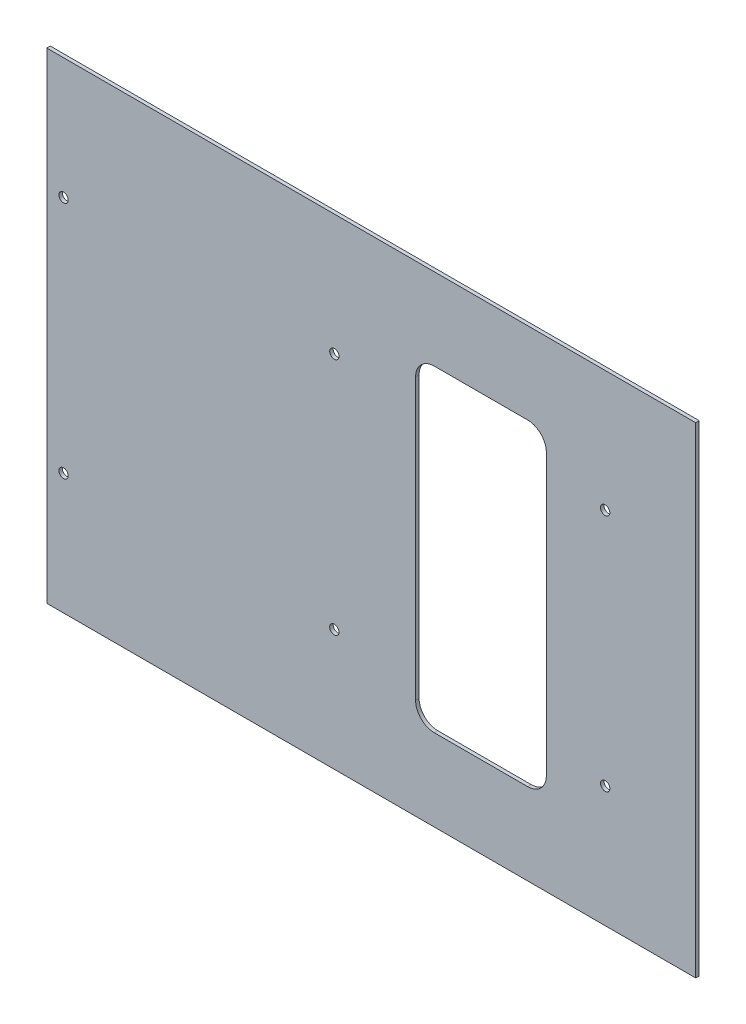
from build123d import *

# Parameters (mm, degrees)
SKETCH1_W          = 882.65
SKETCH1_H          = 654.05
EXTRUDE1_DEPTH     = 4.7625
SKETCH2_R          = 6.35
CUT_EXTRUDE1_DEPTH = 1344.256823743
SKETCH3_W          = 177.8
SKETCH3_H          = 431.8
CUT_EXTRUDE2_DEPTH = 1344.256823743
FILLET1_R          = 25.4


with BuildPart() as part:
    # Sketch1 → Extrude1 (new body)
    with BuildSketch(Plane.XY):
        with Locations((-835.025, 91.6)):
            Rectangle(SKETCH1_W, SKETCH1_H)
    extrude(amount=EXTRUDE1_DEPTH)

    # Sketch2 → Cut-Extrude1 (cut, through all)
    with BuildSketch(Plane(origin=(0, 0, 0), x_dir=(-1, 0, 0), z_dir=(0, 0, -1))):
        with Locations((516.89, 254)):
            Circle(SKETCH2_R)
        with Locations((516.89, -70.8)):
            Circle(SKETCH2_R)
        with Locations((885.19, 254)):
            Circle(SKETCH2_R)
        with Locations((885.19, -70.8)):
            Circle(SKETCH2_R)
        with Locations((1253.49, -70.8)):
            Circle(SKETCH2_R)
        with Locations((1253.49, 254)):
            Circle(SKETCH2_R)
    extrude(amount=-CUT_EXTRUDE1_DEPTH, mode=Mode.SUBTRACT)

    # Sketch3 → Cut-Extrude2 (cut, through all)
    with BuildSketch(Plane.XY.offset(4.7625)):
        with Locations((-685.8, 91.6)):
            Rectangle(SKETCH3_W, SKETCH3_H)
    extrude(amount=-CUT_EXTRUDE2_DEPTH, mode=Mode.SUBTRACT)

    # Fillet1
    fillet1_edges = [part.edges().sort_by_distance(p)[0] for p in [
        (-774.7, -124.3, 2.38125),
        (-596.9, -124.3, 2.38125),
        (-774.7, 307.5, 2.38125),
        (-596.9, 307.5, 2.38125),
    ]]
    fillet(fillet1_edges, radius=FILLET1_R)


solid = part.part
